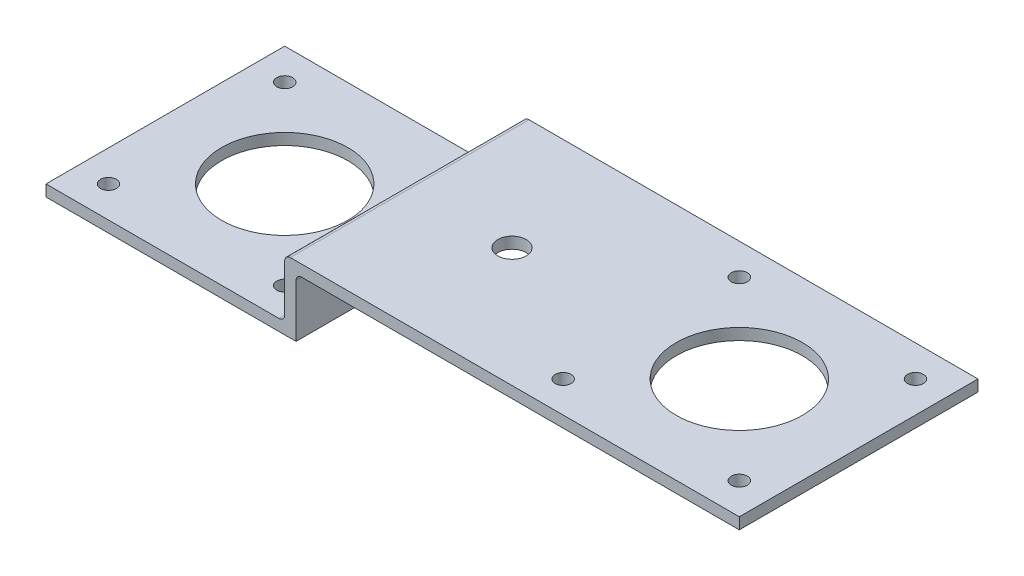
from build123d import *

# Parameters (mm, degrees)
SKETCH1_W               = 38
SKETCH1_H               = 21
SKETCH1_R               = 1.4
BOSS_EXTRUDE1_DEPTH     = 2
CUT_EXTRUDE1_DEPTH      = 104.179455
CUT_EXTRUDE1_DEPTH_BACK = 104.179455
SKETCH3_R               = 11.1
CUT_EXTRUDE2_DEPTH      = 104.179455
CUT_EXTRUDE2_DEPTH_BACK = 104.179455
SKETCH4_R               = 2.5
BOSS_EXTRUDE2_START     = -12.28
BOSS_EXTRUDE2_OUTLINE_R = 1.4
BOSS_EXTRUDE2_DEPTH     = 10.28
CUT_EXTRUDE3_START      = -10.28
SKETCH6_W               = 42
SKETCH6_H               = 42
SKETCH6_R               = 1.4
CUT_EXTRUDE3_DEPTH      = 10.28
CUT_EXTRUDE4_DEPTH      = 110.866639
CUT_EXTRUDE4_DEPTH_BACK = 110.866639
SKETCH7_W               = 17
SKETCH7_H               = 10.28
FILLET1_R               = 1


# Read off the part's stored shape, not the designer's step: Boss-Extrude2
with BuildPart() as part:
    # Sketch1 → Boss-Extrude1 (new body)
    # profile 1 of 4: a face of its own
    with BuildSketch(Plane(origin=(0, 0, 0), x_dir=(1, 0, 0), z_dir=(0, 1, 0))):
        with Locations((40, 10.5)):
            Rectangle(SKETCH1_W, SKETCH1_H)
    # profile 2 of 4: a face of its own
    with BuildSketch(Plane(origin=(0, 0, 0), x_dir=(1, 0, 0), z_dir=(0, 1, 0))):
        Polygon((21, -21), (21, 0), (21, 21), (-21, 21), (-21, -21), align=None)
        with Locations(Location((-15.5, -15.5, 0), (0, 0, 270))):
            Circle(SKETCH1_R, mode=Mode.SUBTRACT)
        with Locations(Location((15.5, -15.5, 0), (0, 0, 270))):
            Circle(SKETCH1_R, mode=Mode.SUBTRACT)
        with Locations(Location((-15.5, 15.5, 0), (0, 0, 270))):
            Circle(SKETCH1_R, mode=Mode.SUBTRACT)
        with Locations(Location((15.5, 15.5, 0), (0, 0, 270))):
            Circle(SKETCH1_R, mode=Mode.SUBTRACT)
    # profile 3 of 4: a face of its own
    with BuildSketch(Plane(origin=(0, 0, 0), x_dir=(1, 0, 0), z_dir=(0, 1, 0))):
        with Locations((40, -10.5)):
            Rectangle(SKETCH1_W, SKETCH1_H)
    # profile 4 of 4: a face of its own
    with BuildSketch(Plane(origin=(0, 0, 0), x_dir=(1, 0, 0), z_dir=(0, 1, 0))):
        Polygon((59, 21), (59, 0), (59, -21), (101, -21), (101, 21), align=None)
        with Locations(Location((64.5, -15.5, 0), (0, 0, 270))):
            Circle(SKETCH1_R, mode=Mode.SUBTRACT)
        with Locations(Location((95.5, -15.5, 0), (0, 0, 270))):
            Circle(SKETCH1_R, mode=Mode.SUBTRACT)
        with Locations(Location((64.5, 15.5, 0), (0, 0, 270))):
            Circle(SKETCH1_R, mode=Mode.SUBTRACT)
        with Locations(Location((95.5, 15.5, 0), (0, 0, 270))):
            Circle(SKETCH1_R, mode=Mode.SUBTRACT)
    extrude(amount=BOSS_EXTRUDE1_DEPTH)

    # Sketch3 → Cut-Extrude1 (cut, two sides: drawn at the far end of the back side and taken through both)
    with BuildSketch(Plane(origin=(0, 2, 0), x_dir=(1, 0, 0), z_dir=(0, 1, 0)).offset(-CUT_EXTRUDE1_DEPTH_BACK)):
        with Locations(Location((80, 0, 0), (0, 0, 270))):
            Circle(SKETCH3_R)
        with Locations(Location((0, 0, 0), (0, 0, 270))):
            Circle(SKETCH3_R)
    extrude(amount=CUT_EXTRUDE1_DEPTH + CUT_EXTRUDE1_DEPTH_BACK, mode=Mode.SUBTRACT)

    # Sketch4 → Cut-Extrude2 (cut, two sides: drawn at the far end of the back side and taken through both)
    with BuildSketch(Plane(origin=(0, 2, 0), x_dir=(1, 0, 0), z_dir=(0, 1, 0)).offset(-CUT_EXTRUDE2_DEPTH_BACK)):
        with Locations(Location((40, 0, 0), (0, 0, 270))):
            Circle(SKETCH4_R)
    extrude(amount=CUT_EXTRUDE2_DEPTH + CUT_EXTRUDE2_DEPTH_BACK, mode=Mode.SUBTRACT)


with BuildPart() as boss_extrude2_tool:
    # Boss-Extrude2 outline → Boss-Extrude2 (new body)
    with BuildSketch(Plane(origin=(0, 2, 0), x_dir=(1, 0, 0), z_dir=(0, 1, 0)).offset(BOSS_EXTRUDE2_START)):
        with BuildLine():
            Line((-21, -21), (40, -21))
            Line((40, -21), (40, -2.5))
            ThreePointArc((40, -2.5), (37.5, 0), (40, 2.5))
            Line((40, 2.5), (40, 21))
            Line((40, 21), (-21, 21))
            Line((-21, 21), (-21, -21))
        make_face()
        with Locations((-15.5, -15.5)):
            Circle(BOSS_EXTRUDE2_OUTLINE_R, mode=Mode.SUBTRACT)
        with Locations((15.5, -15.5)):
            Circle(BOSS_EXTRUDE2_OUTLINE_R, mode=Mode.SUBTRACT)
        with BuildLine():
            add(Edge.make_bspline(
                [(0, -11.1), (-0.726845, -11.100027), (-2.180374, -10.961006), (-4.27463, -10.319187), (-6.209027, -9.292142), (-7.898295, -7.897803), (-9.292338, -6.208724), (-10.319432, -4.274073), (-10.960977, -2.180089), (-11.169529, 0.000347), (-10.960906, 2.180445), (-10.319167, 4.274715), (-9.292137, 6.209025), (-7.897804, 7.898295), (-6.208724, 9.292338), (-4.274073, 10.319432), (-2.180089, 10.960977), (0.000347, 11.169529), (2.180445, 10.960906), (4.274715, 10.319167), (6.209025, 9.292137), (7.898295, 7.897804), (9.292338, 6.208724), (10.319432, 4.274073), (10.960977, 2.180089), (11.169529, -0.000347), (10.960906, -2.180445), (10.319167, -4.274715), (9.292137, -6.209025), (7.897805, -7.898297), (6.208722, -9.292332), (4.274158, -10.319412), (2.180159, -10.960877), (0.726667, -11.099973), (0, -11.1)],
                knots=[0, 0, 0, 0, 0.031254, 0.0625, 0.093758, 0.125, 0.156258, 0.1875, 0.218758, 0.25, 0.281258, 0.3125, 0.343758, 0.375, 0.406258, 0.4375, 0.468758, 0.5, 0.531258, 0.5625, 0.593758, 0.625, 0.656258, 0.6875, 0.718758, 0.75, 0.781258, 0.8125, 0.843758, 0.875, 0.906258, 0.9375, 0.968754, 1, 1, 1, 1], degree=3))
        make_face(mode=Mode.SUBTRACT)
        with Locations((-15.5, 15.5)):
            Circle(BOSS_EXTRUDE2_OUTLINE_R, mode=Mode.SUBTRACT)
        with Locations((15.5, 15.5)):
            Circle(BOSS_EXTRUDE2_OUTLINE_R, mode=Mode.SUBTRACT)
    extrude(amount=BOSS_EXTRUDE2_DEPTH)


with BuildPart() as part_1:
    add(part.part)


with BuildPart() as part_2:
    # Boss-Extrude2: joined with boss_extrude2_tool
    add(part_1.part.fuse(boss_extrude2_tool.part, tol=0.00001))

    # Sketch6 → Cut-Extrude3 (cut)
    with BuildSketch(Plane(origin=(0, 2, 0), x_dir=(1, 0, 0), z_dir=(0, 1, 0)).offset(CUT_EXTRUDE3_START)):
        Rectangle(SKETCH6_W, SKETCH6_H)
        with Locations(Location((15.5, 15.5, 0), (0, 0, 270))):
            Circle(SKETCH6_R, mode=Mode.SUBTRACT)
        with Locations(Location((-15.5, 15.5, 0), (0, 0, 270))):
            Circle(SKETCH6_R, mode=Mode.SUBTRACT)
        with Locations(Location((-15.5, -15.5, 0), (0, 0, 270))):
            Circle(SKETCH6_R, mode=Mode.SUBTRACT)
        with Locations(Location((15.5, -15.5, 0), (0, 0, 270))):
            Circle(SKETCH6_R, mode=Mode.SUBTRACT)
    extrude(amount=CUT_EXTRUDE3_DEPTH, mode=Mode.SUBTRACT)

    # Sketch7 → Cut-Extrude4 (cut, two sides: drawn at the far end of the back side and taken through both)
    with BuildSketch(Plane.XY.offset(21).offset(-CUT_EXTRUDE4_DEPTH_BACK)):
        with Locations((31.5, -5.14)):
            Rectangle(SKETCH7_W, SKETCH7_H)
    extrude(amount=CUT_EXTRUDE4_DEPTH + CUT_EXTRUDE4_DEPTH_BACK, mode=Mode.SUBTRACT)

    # Fillet1
    fillet1_edges = [part_2.edges().sort_by_distance(p)[0] for p in [
        (21, -8.28, 0),
        (21, 2, 0),
        (23, 0, 0),
    ]]
    fillet(fillet1_edges, radius=FILLET1_R)


solid = part_2.part
